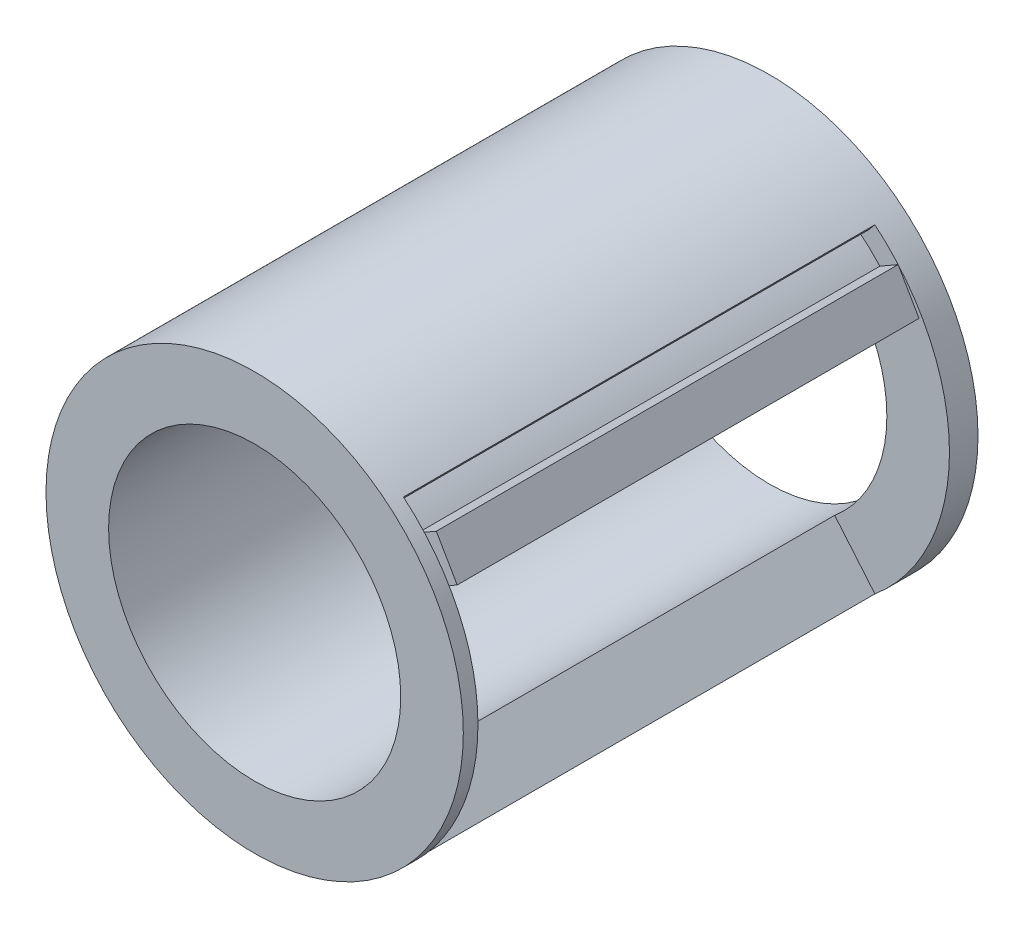
from build123d import *

# Parameters (mm, degrees)
ESQUISSE1_R                                   = 15
ESQUISSE1_R_2                                 = 10.5
BOSS_EXTRU_3_DEPTH                            = 100
ESQUISSE9_W                                   = 5
ESQUISSE9_H                                   = 2
ENL_VEMENT_START                              = 10
ENL_VEMENT_DE_MATI_RE_R_VOLUTION2_DEPTH       = 5
R_P_TITION_CIRCULAIRE1_COUNT                  = 4
ESQUISSE11_R                                  = 2
ESQUISSE12_W                                  = 4
ESQUISSE12_H                                  = 5
ESQUISSE13_W                                  = 3
ESQUISSE13_H                                  = 5
CONG_2_R                                      = 1
CONG_3_R                                      = 1
CONG_4_R                                      = 1
CONG_5_R                                      = 1
ENL_V_MAT_EXTRU_2_DEPTH                       = 103.824588457
ENL_V_MAT_EXTRU_2_DEPTH_BACK                  = 103.824588457
ESQUISSE16_R                                  = 1.75
ESQUISSE19_W                                  = 13.434398634
ESQUISSE19_H                                  = 33.894617108
ENL_VEMENT_DE_MATI_RE_R_VOLUTION4_ANGLE       = 50
ENL_VEMENT_DE_MATI_RE_R_VOLUTION4_OTHER_ANGLE = 50
ESQUISSE20_W                                  = 33.894617108
ESQUISSE20_H                                  = 2.5
ESQUISSE25_R                                  = 1.75
ENL_V_MAT_EXTRU_3_DEPTH                       = 103.824588457
BOSS_EXTRU_4_REACH                            = 65.719
ESQUISSE29_W                                  = 33.894617108
ESQUISSE29_H                                  = 3.1234995
ENL_VEMENT_DE_MATI_RE_R_VOLUTION7_ANGLE       = 100
ESQUISSE32_W                                  = 33.2
ESQUISSE32_H                                  = 2.5
R_VOLUTION4_ANGLE                             = 20
R_VOLUTION4_OTHER_WAY_ANGLE                   = 90
BOSS_EXTRU_5_DEPTH                            = 2
BOSS_EXTRU_5_DEPTH_BACK                       = 1
ESQUISSE34_W                                  = 3
ESQUISSE34_H                                  = 33.2
ESQUISSE35_R                                  = 19
BOSS_EXTRU_6_DEPTH                            = 10
ESQUISSE36_R                                  = 10
ESQUISSE36_R_2                                = 7.5
BOSS_EXTRU_7_DEPTH                            = 50
ESQUISSE39_R                                  = 5
BOSS_EXTRU_8_DEPTH                            = 21
ESQUISSE41_R                                  = 23.968073598
ENL_V_MAT_EXTRU_4_DEPTH                       = 57
ESQUISSE42_R                                  = 25.631074034
ENL_V_MAT_EXTRU_5_DEPTH                       = 66


# Read off the part's stored shape, not the designer's step: Enlèvement de matière-Révolution2
with BuildPart() as part:
    # Esquisse1 → Boss.-Extru.3 (new body)
    with BuildSketch(Plane.XY):
        Circle(ESQUISSE1_R)
        Circle(ESQUISSE1_R_2, mode=Mode.SUBTRACT)
    extrude(amount=BOSS_EXTRU_3_DEPTH)

    # Esquisse9 → Enlèvement de matière-Révolution1 (revolve, cut)
    with BuildSketch(Plane(origin=(0, 0, 0), x_dir=(0, 0, -1), z_dir=(1, 0, 0)), mode=Mode.PRIVATE) as enl_vement_de_mati_re_r_volution1_sk:
        with Locations((-7.5, -15)):
            Rectangle(ESQUISSE9_W, ESQUISSE9_H)
    revolve(enl_vement_de_mati_re_r_volution1_sk.sketch.rotate(Axis((0, 0, 100), (0, 0, -1)), 270), axis=Axis((0, 0, 100), (0, 0, -1)), mode=Mode.SUBTRACT)

    # Enlèvement de matière-Révolution2 outlin → Enlèvement de matière-Révolution2 (cut)
    with BuildSketch(Plane.XY.offset(ENL_VEMENT_START)):
        with BuildLine():
            Line((-2.431074487, -13.787308542), (-2.604722665, -14.772116295))
            ThreePointArc((-2.604722665, -14.772116295), (0, -15), (2.604722665, -14.772116295))
            Line((2.604722665, -14.772116295), (2.431074487, -13.787308542))
            ThreePointArc((2.431074487, -13.787308542), (0, -14), (-2.431074487, -13.787308542))
        make_face()
    enl_vement_de_mati_re_r_volution2 = extrude(amount=ENL_VEMENT_DE_MATI_RE_R_VOLUTION2_DEPTH, mode=Mode.SUBTRACT)

    # Répétition circulaire1: Enlèvement de matière-Révolution2 ×4 about axis
    r_p_tition_circulaire1_axis = Axis((0, 0, 0), (0, 0, 1))
    for i in range(1, R_P_TITION_CIRCULAIRE1_COUNT):
        add(enl_vement_de_mati_re_r_volution2.rotate(r_p_tition_circulaire1_axis, i * 360 / R_P_TITION_CIRCULAIRE1_COUNT), mode=Mode.SUBTRACT)

    # Esquisse11 → Enlèvement de matière-Révolution3 (revolve, cut)
    with BuildSketch(Plane(origin=(0, 0, 0), x_dir=(1, 0, 0), z_dir=(0, 1, 0)), mode=Mode.PRIVATE) as enl_vement_de_mati_re_r_volution3_sk:
        with Locations((15, -50)):
            Circle(ESQUISSE11_R)
    revolve(enl_vement_de_mati_re_r_volution3_sk.sketch.rotate(Axis((0, 0, 100), (0, 0, -1)), 190), axis=Axis((0, 0, 100), (0, 0, -1)), mode=Mode.SUBTRACT)

    # Esquisse12 → Révolution1 (revolve)
    with BuildSketch(Plane(origin=(0, 0, 0), x_dir=(1, 0, 0), z_dir=(0, 1, 0))):
        with Locations((14.924774562, -54.5)):
            Rectangle(ESQUISSE12_W, ESQUISSE12_H)
    revolve(axis=Axis((0, 0, 100), (0, 0, -1)))

    # Esquisse13 → Révolution2 (revolve)
    with BuildSketch(Plane(origin=(0, 0, 0), x_dir=(1, 0, 0), z_dir=(0, 1, 0)), mode=Mode.PRIVATE) as r_volution2_sk:
        with Locations((15, -97.5)):
            Rectangle(ESQUISSE13_W, ESQUISSE13_H)
    revolve(r_volution2_sk.sketch.rotate(Axis((0, 0, 100), (0, 0, -1)), 190), axis=Axis((0, 0, 100), (0, 0, -1)))

    # Congé2
    cong_2_edges = [part.edges().sort_by_distance(p)[0] for p in [
        (-16.924774562, 0, 52),
    ]]
    fillet(cong_2_edges, radius=CONG_2_R)

    # Congé3
    cong_3_edges = [part.edges().sort_by_distance(p)[0] for p in [
        (-16.924774562, 0, 57),
    ]]
    fillet(cong_3_edges, radius=CONG_3_R)

    # Congé4
    cong_4_edges = [part.edges().sort_by_distance(p)[0] for p in [
        (16.249327925, -2.865194932, 95),
        (16.249327925, -2.865194932, 100),
    ]]
    fillet(cong_4_edges, radius=CONG_4_R)

    # Congé5
    cong_5_edges = [part.edges().sort_by_distance(p)[0] for p in [
        (-1.307336141, -14.942920471, 48),
    ]]
    fillet(cong_5_edges, radius=CONG_5_R)

    # Esquisse16 → Enlèv. mat.-Extru.2 (cut, two sides: drawn at the far end of the back side and taken through both)
    with BuildSketch(Plane(origin=(0, 0, 0), x_dir=(0, 0, -1), z_dir=(1, 0, 0)).offset(-ENL_V_MAT_EXTRU_2_DEPTH_BACK)):
        with Locations((-12.5, 0)):
            Circle(ESQUISSE16_R)
    extrude(amount=ENL_V_MAT_EXTRU_2_DEPTH + ENL_V_MAT_EXTRU_2_DEPTH_BACK, mode=Mode.SUBTRACT)

    # Esquisse19 → Enlèvement de matière-Révolution4 (revolve, cut)
    with BuildSketch(Plane(origin=(0, 0, 0), x_dir=(1, 0, 0), z_dir=(0, 1, 0))):
        with Locations((15, -76)):
            Rectangle(ESQUISSE19_W, ESQUISSE19_H)
    revolve(axis=Axis((0, 0, 100), (0, 0, -1)), revolution_arc=ENL_VEMENT_DE_MATI_RE_R_VOLUTION4_ANGLE, mode=Mode.SUBTRACT)

    # Esquisse19 → Enlèvement de matière-Révolution4 other (revolve, cut)
    with BuildSketch(Plane(origin=(0, 0, 0), x_dir=(1, 0, 0), z_dir=(0, 1, 0))):
        with Locations((15, -76)):
            Rectangle(ESQUISSE19_W, ESQUISSE19_H)
    revolve(axis=Axis((0, 0, 100), (0, 0, 1)), revolution_arc=ENL_VEMENT_DE_MATI_RE_R_VOLUTION4_OTHER_ANGLE, mode=Mode.SUBTRACT)

    # Esquisse20 → Enlèvement de matière-Révolution5 (revolve, cut)
    with BuildSketch(Plane(origin=(0, 0, 0), x_dir=(0, 0, -1), z_dir=(0.7660444431189792, 0.642787609686538, 0)), mode=Mode.PRIVATE) as enl_vement_de_mati_re_r_volution5_sk:
        with Locations((-76, -10.5)):
            Rectangle(ESQUISSE20_W, ESQUISSE20_H)
    revolve(enl_vement_de_mati_re_r_volution5_sk.sketch.rotate(Axis((0, 0, 100), (0, 0, -1)), 140), axis=Axis((0, 0, 100), (0, 0, -1)), mode=Mode.SUBTRACT)

    # Esquisse25 → Enlèv. mat.-Extru.3 (cut, through all)
    with BuildSketch(Plane(origin=(0, 0, 0), x_dir=(0, 0, -1), z_dir=(1, 0, 0))):
        with Locations(Location((-97.5, 0, 0), (0, 0, 180))):
            Circle(ESQUISSE25_R)
        with Locations(Location((-54.5, 0, 0), (0, 0, 180))):
            Circle(ESQUISSE25_R)
    extrude(amount=ENL_V_MAT_EXTRU_3_DEPTH, mode=Mode.SUBTRACT)

    # Esquisse28 → Boss.-Extru.4 (add, up to next)
    with BuildSketch(Plane.XY.offset(59.052691446), mode=Mode.PRIVATE) as boss_extru_4_sk1:
        with BuildLine():
            Line((6.749269902, 8.043466653), (7.552754414, 9.001022207))
            ThreePointArc((7.552754414, 9.001022207), (-11.75, 0), (7.552754414, -9.001022207))
            Line((7.552754414, -9.001022207), (6.749269902, -8.043466653))
            ThreePointArc((6.749269902, -8.043466653), (-10.5, 0), (6.749269902, 8.043466653))
        make_face()
    boss_extru_4_tool1 = extrude(boss_extru_4_sk1.sketch, amount=BOSS_EXTRU_4_REACH, mode=Mode.PRIVATE) - part.part
    add(boss_extru_4_tool1.solids().sort_by_distance((-10.804113, 0, 59.052691))[0])

    # Esquisse29 → Enlèvement de matière-Révolution7 (revolve, cut)
    with BuildSketch(Plane(origin=(0, 0, 0), x_dir=(0, 0, -1), z_dir=(0.7660444431189792, -0.6427876096865379, 0))):
        with Locations((-76, 12.75)):
            Rectangle(ESQUISSE29_W, ESQUISSE29_H)
    revolve(axis=Axis((0, 0, 100), (0, 0, 1)), revolution_arc=ENL_VEMENT_DE_MATI_RE_R_VOLUTION7_ANGLE, mode=Mode.SUBTRACT)

    # Esquisse35 → Boss.-Extru.6 (add)
    with BuildSketch(Plane.XY.offset(100)):
        Circle(ESQUISSE35_R)
    extrude(amount=BOSS_EXTRU_6_DEPTH)

    # Esquisse36 → Boss.-Extru.7 (add)
    with BuildSketch(Plane.XY.offset(110)):
        Circle(ESQUISSE36_R)
        Circle(ESQUISSE36_R_2, mode=Mode.SUBTRACT)
    extrude(amount=BOSS_EXTRU_7_DEPTH)

    # Esquisse39 → Boss.-Extru.8 (add)
    with BuildSketch(Plane(origin=(0, 0, 0), x_dir=(0, 0, -1), z_dir=(1, 0, 0))):
        with Locations((-105, 0)):
            Circle(ESQUISSE39_R)
    extrude(amount=BOSS_EXTRU_8_DEPTH)

    # Esquisse40 → Enlèvement de matière-Révolution9 (revolve, cut)
    with BuildSketch(Plane(origin=(21, 0, 0), x_dir=(0, 0, -1), z_dir=(1, 0, 0))):
        with BuildLine():
            Line((-107.5, 0), (-102.5, 0))
            ThreePointArc((-102.5, 0), (-105, -2.5), (-107.5, 0))
        make_face()
    revolve(axis=Axis((21, 0, 107.5), (0, 0, -1)), mode=Mode.SUBTRACT)

    # Esquisse41 → Enlèv. mat.-Extru.4 (cut)
    with BuildSketch(Plane.XY):
        Circle(ESQUISSE41_R)
    extrude(amount=ENL_V_MAT_EXTRU_4_DEPTH, mode=Mode.SUBTRACT)

    # Esquisse42 → Enlèv. mat.-Extru.5 (cut)
    with BuildSketch(Plane.XY.offset(160)):
        Circle(ESQUISSE42_R)
    extrude(amount=-ENL_V_MAT_EXTRU_5_DEPTH, mode=Mode.SUBTRACT)


with BuildPart() as body_2:
    # Esquisse32 → Révolution4 (revolve)
    with BuildSketch(Plane(origin=(0, 0, 0), x_dir=(0, 0, -1), z_dir=(0.7660444431189792, -0.6427876096865379, 0))):
        with Locations((-76, 12.75)):
            Rectangle(ESQUISSE32_W, ESQUISSE32_H)
    revolve(axis=Axis((0, 0, 100), (0, 0, -1)), revolution_arc=R_VOLUTION4_ANGLE)

    # Esquisse32 → Révolution4 other way (revolve)
    with BuildSketch(Plane(origin=(0, 0, 0), x_dir=(0, 0, -1), z_dir=(0.7660444431189792, -0.6427876096865379, 0))):
        with Locations((-76, 12.75)):
            Rectangle(ESQUISSE32_W, ESQUISSE32_H)
    revolve(axis=Axis((0, 0, 100), (0, 0, 1)), revolution_arc=R_VOLUTION4_OTHER_WAY_ANGLE)

    # Esquisse34 → Boss.-Extru.5 (add, two sides: drawn at the far end of the back side and taken through both)
    with BuildSketch(Plane(origin=(11.428132998, 6.598035663, 0), x_dir=(-0.5000000000000011, 0.8660254037844382, -9.071134608832366e-15), z_dir=(0.8660254037844382, 0.5000000000000011, 1.7457406694215556e-15)).offset(-BOSS_EXTRU_5_DEPTH_BACK)):
        with Locations((1.5, 76)):
            Rectangle(ESQUISSE34_W, ESQUISSE34_H)
    extrude(amount=BOSS_EXTRU_5_DEPTH + BOSS_EXTRU_5_DEPTH_BACK)


solid = Compound([part.part, body_2.part])
